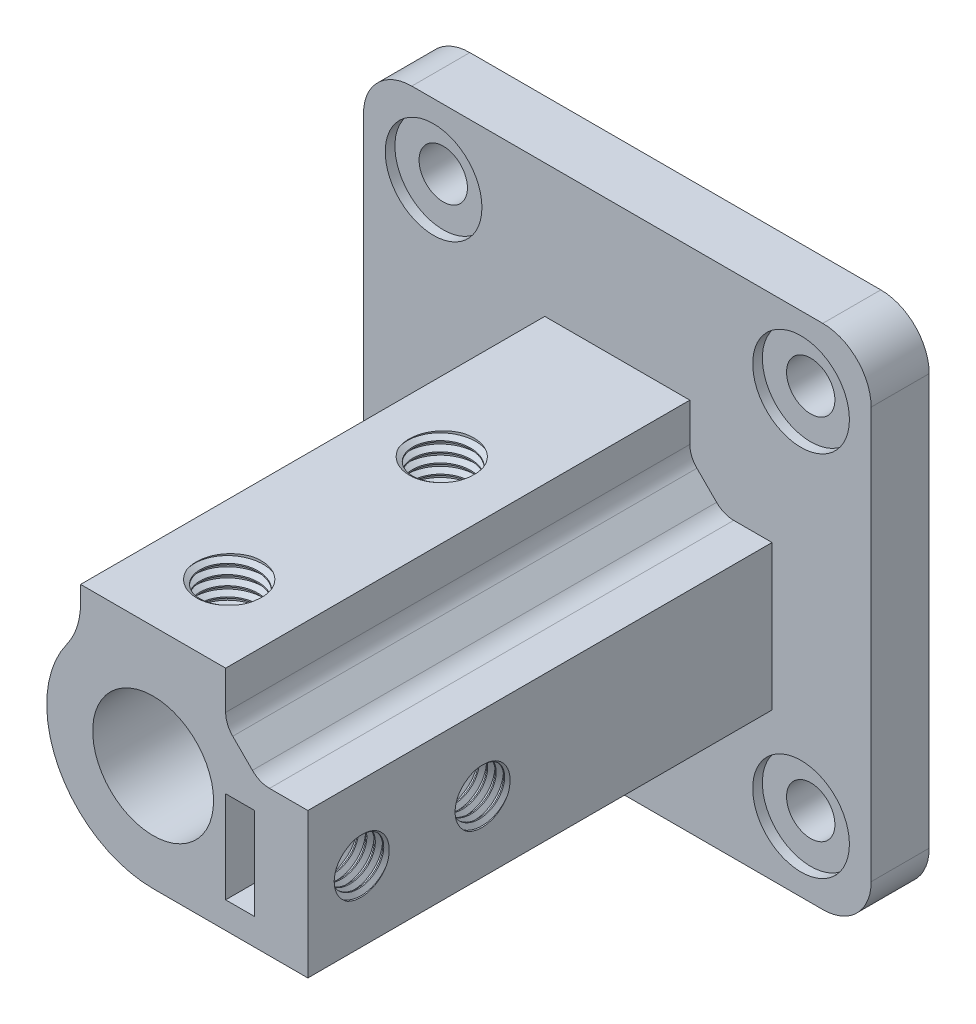
from build123d import *

# Parameters (mm, degrees)
BOSS_EXTRUDE1_DEPTH                     = 12
BOSS_EXTRUDE2_DEPTH                     = 108
CUT_EXTRUDE1_START                      = 108
SKETCH1_5_W                             = 6
SKETCH1_5_H                             = 19
CUT_EXTRUDE1_DEPTH                      = 48
F_25_0MM_DOWEL_HOLE1_D                  = 25
F_25_0MM_DOWEL_HOLE1_DEPTH              = 74.489242262
F_25_0MM_DOWEL_HOLE1_TIP                = 7.510757738
CBORE_FOR_M5_HEX_HEAD_BOLT1_D           = 10
CBORE_FOR_M5_HEX_HEAD_BOLT1_CBORE_D     = 20
CBORE_FOR_M5_HEX_HEAD_BOLT1_CBORE_DEPTH = 2
M12X1_75_TAPPED_HOLE1_D                 = 10.2
M12X1_75_TAPPED_HOLE1_DEPTH             = 11
M12X1_75_TAPPED_HOLE1_TIP               = 3.064389157
THREAD1_PITCH                           = 1.75
THREAD2_PITCH                           = 1.75
M14X2_0_TAPPED_HOLE1_REACH              = 133.25
M14X2_0_TAPPED_HOLE1_BORE_R             = 6
THREAD3_PITCH                           = 2
THREAD4_PITCH                           = 2


with BuildPart() as part:
    # Sketch1 → Boss-Extrude1 (new body)
    with BuildSketch(Plane.XY):
        with BuildLine():
            Line((-42.5, 52.5), (42.5, 52.5))
            ThreePointArc((42.5, 52.5), (49.571067812, 49.571067812), (52.5, 42.5))
            Line((52.5, 42.5), (52.5, -42.5))
            ThreePointArc((52.5, -42.5), (49.571067812, -49.571067812), (42.5, -52.5))
            Line((42.5, -52.5), (-42.5, -52.5))
            ThreePointArc((-42.5, -52.5), (-49.571067812, -49.571067812), (-52.5, -42.5))
            Line((-52.5, -42.5), (-52.5, 42.5))
            ThreePointArc((-52.5, 42.5), (-49.571067812, 49.571067812), (-42.5, 52.5))
        make_face()
    extrude(amount=BOSS_EXTRUDE1_DEPTH)

    # Sketch1<4> → Boss-Extrude2 (add)
    with BuildSketch(Plane.XY):
        with BuildLine():
            Line((-15, 25), (15, 25))
            Line((15, 25), (15, 17.071067812))
            ThreePointArc((15, 17.071067812), (15.380602337, 15.15765065), (16.464466094, 13.535533906))
            Line((16.464466094, 13.535533906), (20.535533906, 9.464466094))
            ThreePointArc((20.535533906, 9.464466094), (22.15765065, 8.380602337), (24.071067812, 8))
            Line((24.071067812, 8), (32, 8))
            Line((32, 8), (32, -22))
            Line((32, -22), (0, -22))
            ThreePointArc((0, -22), (-19.586847969, -10.017753573), (-17.837837838, 12.876783033))
            ThreePointArc((-17.837837838, 12.876783033), (-15.72708102, 17.042972688), (-15, 21.656407828))
            Line((-15, 21.656407828), (-15, 25))
        make_face()
    extrude(amount=BOSS_EXTRUDE2_DEPTH)

    # Sketch1<5> → Cut-Extrude1 (cut)
    with BuildSketch(Plane.XY.offset(CUT_EXTRUDE1_START)):
        with Locations((18, -7)):
            Rectangle(SKETCH1_5_W, SKETCH1_5_H)
    extrude(amount=-CUT_EXTRUDE1_DEPTH, mode=Mode.SUBTRACT)

    # Ø25.0mm Dowel Hole1
    with Locations(Plane.XY.offset(108)):
        with Locations((0, 0)):
            Hole(F_25_0MM_DOWEL_HOLE1_D / 2, depth=F_25_0MM_DOWEL_HOLE1_DEPTH)
            with Locations((0, 0, -(F_25_0MM_DOWEL_HOLE1_DEPTH + F_25_0MM_DOWEL_HOLE1_TIP / 2))):  # 118° drill point
                Cone(0, F_25_0MM_DOWEL_HOLE1_D / 2, F_25_0MM_DOWEL_HOLE1_TIP, mode=Mode.SUBTRACT)

    # CBORE for M5 Hex Head Bolt1 (through all)
    with Locations(Plane(origin=(37.999995657, 38.025691776, 12), x_dir=(1, 0, 0), z_dir=(0, 0, 1))):
        with Locations((0, 0), (-75.999995657, -0.025691776)):
            cbore_for_m5_hex_head_bolt1 = CounterBoreHole(CBORE_FOR_M5_HEX_HEAD_BOLT1_D / 2, CBORE_FOR_M5_HEX_HEAD_BOLT1_CBORE_D / 2, CBORE_FOR_M5_HEX_HEAD_BOLT1_CBORE_DEPTH)

    # Mirror1: CBORE for M5 Hex Head Bolt1 across plane
    add(cbore_for_m5_hex_head_bolt1.mirror(Plane.ZX), mode=Mode.SUBTRACT)

    # M12x1.75 Tapped Hole1
    with Locations(Plane(origin=(32, -7, 97), x_dir=(0, 0, 1), z_dir=(1, 0, 0))):
        with Locations((0, 0), (-25, 0)):
            Hole(M12X1_75_TAPPED_HOLE1_D / 2, depth=M12X1_75_TAPPED_HOLE1_DEPTH)
            with Locations((0, 0, -(M12X1_75_TAPPED_HOLE1_DEPTH + M12X1_75_TAPPED_HOLE1_TIP / 2))):  # 118° drill point
                Cone(0, M12X1_75_TAPPED_HOLE1_D / 2, M12X1_75_TAPPED_HOLE1_TIP, mode=Mode.SUBTRACT)

    # Thread1: the profile of Thread Profile1 profile screwed along a right-hand helix of 8.571429 turns, 10 arcs to a turn; built about Z, then put on its axis
    thread1_z = Axis((0, 0, 0), (0, 0, 1))
    thread1_corners = [(5.0997, 0, -0.000173205), (5.0997, 0, 1.5314232), (6.047215281, 0, 0.984374998), (6.047215281, 0, 0.546874998)]
    with BuildLine(mode=Mode.PRIVATE) as thread1_profile:
        Line(thread1_corners[0], thread1_corners[1])
        Line(thread1_corners[1], thread1_corners[2])
        Line(thread1_corners[2], thread1_corners[3])
        Line(thread1_corners[3], thread1_corners[0])
    thread1_cap = Face(thread1_profile.wire())
    thread1_turn_angles = [0, 18, 36, 54, 72, 90, 108, 126, 144, 162, 180, 198, 216, 234, 252, 270, 288, 306, 324, 342, 360]
    thread1_turn_weights = [1, 0.9510565162951535, 1, 0.9510565162951535, 1, 0.9510565162951535, 1, 0.9510565162951535, 1, 0.9510565162951535, 1, 0.9510565162951535, 1, 0.9510565162951535, 1, 0.9510565162951535, 1, 0.9510565162951535, 1, 0.9510565162951535, 1]
    thread1_turn_rails = [Edge.make_bspline([Vector(p[0], p[1], 0).rotate(thread1_z, thread1_turn_angles[k]) / thread1_turn_weights[k] + Vector(0, 0, p[2] + THREAD1_PITCH * thread1_turn_angles[k] / 360) for k in range(21)], [0, 0, 0, 1, 1, 2, 2, 3, 3, 4, 4, 5, 5, 6, 6, 7, 7, 8, 8, 9, 9, 10, 10, 10], 2, thread1_turn_weights) for p in thread1_corners]
    thread1_turn_sides = [Face.make_surface_from_curves(thread1_turn_rails[p[0]], thread1_turn_rails[p[1]]) for p in [(0, 1), (1, 2), (2, 3), (3, 0)]]
    thread1_last_angles = [2880, 2898, 2916, 2934, 2952, 2970, 2988, 3006, 3024, 3042, 3060, 3072.857142857, 3085.714285714]
    thread1_last_weights = [1, 0.9510565162951535, 1, 0.9510565162951535, 1, 0.9510565162951535, 1, 0.9510565162951535, 1, 0.9510565162951535, 1, 0.9749279121818235, 1]
    thread1_last_rails = [Edge.make_bspline([Vector(p[0], p[1], 0).rotate(thread1_z, thread1_last_angles[k]) / thread1_last_weights[k] + Vector(0, 0, p[2] + THREAD1_PITCH * thread1_last_angles[k] / 360) for k in range(13)], [0, 0, 0, 1, 1, 2, 2, 3, 3, 4, 4, 5, 5, 6, 6, 6], 2, thread1_last_weights) for p in thread1_corners]
    thread1_last_sides = [Face.make_surface_from_curves(thread1_last_rails[p[0]], thread1_last_rails[p[1]]) for p in [(0, 1), (1, 2), (2, 3), (3, 0)]]
    thread1 = Plane(origin=(34, -7, 72), x_dir=(0, 0, 1), z_dir=(-1, 0, 0)) * Solid(Shell([*[p.moved(Location((0, 0, THREAD1_PITCH * i))) for i in range(8) for p in thread1_turn_sides], *thread1_last_sides, thread1_cap, thread1_cap.rotate(thread1_z, 3085.714285714).moved(Location((0, 0, THREAD1_PITCH * 3085.714285714 / 360)))]))
    add(thread1, mode=Mode.SUBTRACT)

    # Thread2: the profile of Thread Profile2 profile screwed along a right-hand helix of 8.571429 turns, 10 arcs to a turn; built about Z, then put on its axis
    thread2_z = Axis((0, 0, 0), (0, 0, 1))
    thread2_corners = [(5.0997, 0, -0.000173205), (5.0997, 0, 1.5314232), (6.047215281, 0, 0.984374998), (6.047215281, 0, 0.546874998)]
    with BuildLine(mode=Mode.PRIVATE) as thread2_profile:
        Line(thread2_corners[0], thread2_corners[1])
        Line(thread2_corners[1], thread2_corners[2])
        Line(thread2_corners[2], thread2_corners[3])
        Line(thread2_corners[3], thread2_corners[0])
    thread2_cap = Face(thread2_profile.wire())
    thread2_turn_angles = [0, 18, 36, 54, 72, 90, 108, 126, 144, 162, 180, 198, 216, 234, 252, 270, 288, 306, 324, 342, 360]
    thread2_turn_weights = [1, 0.9510565162951535, 1, 0.9510565162951535, 1, 0.9510565162951535, 1, 0.9510565162951535, 1, 0.9510565162951535, 1, 0.9510565162951535, 1, 0.9510565162951535, 1, 0.9510565162951535, 1, 0.9510565162951535, 1, 0.9510565162951535, 1]
    thread2_turn_rails = [Edge.make_bspline([Vector(p[0], p[1], 0).rotate(thread2_z, thread2_turn_angles[k]) / thread2_turn_weights[k] + Vector(0, 0, p[2] + THREAD2_PITCH * thread2_turn_angles[k] / 360) for k in range(21)], [0, 0, 0, 1, 1, 2, 2, 3, 3, 4, 4, 5, 5, 6, 6, 7, 7, 8, 8, 9, 9, 10, 10, 10], 2, thread2_turn_weights) for p in thread2_corners]
    thread2_turn_sides = [Face.make_surface_from_curves(thread2_turn_rails[p[0]], thread2_turn_rails[p[1]]) for p in [(0, 1), (1, 2), (2, 3), (3, 0)]]
    thread2_last_angles = [2880, 2898, 2916, 2934, 2952, 2970, 2988, 3006, 3024, 3042, 3060, 3072.857142857, 3085.714285714]
    thread2_last_weights = [1, 0.9510565162951535, 1, 0.9510565162951535, 1, 0.9510565162951535, 1, 0.9510565162951535, 1, 0.9510565162951535, 1, 0.9749279121818235, 1]
    thread2_last_rails = [Edge.make_bspline([Vector(p[0], p[1], 0).rotate(thread2_z, thread2_last_angles[k]) / thread2_last_weights[k] + Vector(0, 0, p[2] + THREAD2_PITCH * thread2_last_angles[k] / 360) for k in range(13)], [0, 0, 0, 1, 1, 2, 2, 3, 3, 4, 4, 5, 5, 6, 6, 6], 2, thread2_last_weights) for p in thread2_corners]
    thread2_last_sides = [Face.make_surface_from_curves(thread2_last_rails[p[0]], thread2_last_rails[p[1]]) for p in [(0, 1), (1, 2), (2, 3), (3, 0)]]
    thread2 = Plane(origin=(34, -7, 97), x_dir=(0, 0, 1), z_dir=(-1, 0, 0)) * Solid(Shell([*[p.moved(Location((0, 0, THREAD2_PITCH * i))) for i in range(8) for p in thread2_turn_sides], *thread2_last_sides, thread2_cap, thread2_cap.rotate(thread2_z, 3085.714285714).moved(Location((0, 0, THREAD2_PITCH * 3085.714285714 / 360)))]))
    add(thread2, mode=Mode.SUBTRACT)

    # M14x2.0 Tapped Hole1 bore (on position points) → M14x2.0 Tapped Hole1 (cut, up to next)
    with BuildSketch(Plane(origin=(0, 25, 92), x_dir=(1, 0, 0), z_dir=(0, 1, 0)), mode=Mode.PRIVATE) as m14x2_0_tapped_hole1_sk1:
        Circle(M14X2_0_TAPPED_HOLE1_BORE_R)
    m14x2_0_tapped_hole1_tool1 = extrude(m14x2_0_tapped_hole1_sk1.sketch, amount=-M14X2_0_TAPPED_HOLE1_REACH, mode=Mode.PRIVATE) & part.part
    # M14x2.0 Tapped Hole1 bore (on position points) → M14x2.0 Tapped Hole1 (cut, up to next)
    with BuildSketch(Plane(origin=(0, 25, 92), x_dir=(1, 0, 0), z_dir=(0, 1, 0)), mode=Mode.PRIVATE) as m14x2_0_tapped_hole1_sk2:
        with Locations((0, 44)):
            Circle(M14X2_0_TAPPED_HOLE1_BORE_R)
    m14x2_0_tapped_hole1_tool2 = extrude(m14x2_0_tapped_hole1_sk2.sketch, amount=-M14X2_0_TAPPED_HOLE1_REACH, mode=Mode.PRIVATE) & part.part
    add(m14x2_0_tapped_hole1_tool1.solids().sort_by_distance((0, 25, 92))[0], mode=Mode.SUBTRACT)
    add(m14x2_0_tapped_hole1_tool2.solids().sort_by_distance((0, 25, 48))[0], mode=Mode.SUBTRACT)

    # Thread3: the profile of Thread Profile3 profile screwed along a right-hand helix of 10 turns, 10 arcs to a turn; built about Z, then put on its axis
    thread3_z = Axis((0, 0, 0), (0, 0, 1))
    thread3_corners = [(5.9997, 0, -0.000173205), (5.9997, 0, 1.7501732), (7.08253175, 0, 1.124999997), (7.08253175, 0, 0.624999997)]
    with BuildLine(mode=Mode.PRIVATE) as thread3_profile:
        Line(thread3_corners[0], thread3_corners[1])
        Line(thread3_corners[1], thread3_corners[2])
        Line(thread3_corners[2], thread3_corners[3])
        Line(thread3_corners[3], thread3_corners[0])
    thread3_cap = Face(thread3_profile.wire())
    thread3_turn_angles = [0, 18, 36, 54, 72, 90, 108, 126, 144, 162, 180, 198, 216, 234, 252, 270, 288, 306, 324, 342, 360]
    thread3_turn_weights = [1, 0.9510565162951535, 1, 0.9510565162951535, 1, 0.9510565162951535, 1, 0.9510565162951535, 1, 0.9510565162951535, 1, 0.9510565162951535, 1, 0.9510565162951535, 1, 0.9510565162951535, 1, 0.9510565162951535, 1, 0.9510565162951535, 1]
    thread3_turn_rails = [Edge.make_bspline([Vector(p[0], p[1], 0).rotate(thread3_z, thread3_turn_angles[k]) / thread3_turn_weights[k] + Vector(0, 0, p[2] + THREAD3_PITCH * thread3_turn_angles[k] / 360) for k in range(21)], [0, 0, 0, 1, 1, 2, 2, 3, 3, 4, 4, 5, 5, 6, 6, 7, 7, 8, 8, 9, 9, 10, 10, 10], 2, thread3_turn_weights) for p in thread3_corners]
    thread3_turn_sides = [Face.make_surface_from_curves(thread3_turn_rails[p[0]], thread3_turn_rails[p[1]]) for p in [(0, 1), (1, 2), (2, 3), (3, 0)]]
    thread3 = Plane(origin=(0, 28, 48), x_dir=(-1, 0, 0), z_dir=(0, -1, 0)) * Solid(Shell([*[p.moved(Location((0, 0, THREAD3_PITCH * i))) for i in range(10) for p in thread3_turn_sides], thread3_cap, thread3_cap.rotate(thread3_z, 3600).moved(Location((0, 0, THREAD3_PITCH * 3600 / 360)))]))
    add(thread3, mode=Mode.SUBTRACT)

    # Thread4: the profile of Thread Profile4 profile screwed along a right-hand helix of 10 turns, 10 arcs to a turn; built about Z, then put on its axis
    thread4_z = Axis((0, 0, 0), (0, 0, 1))
    thread4_corners = [(5.9997, 2e-09, -0.000173205), (5.9997, 2e-09, 1.7501732), (7.08253175, 2e-09, 1.124999997), (7.08253175, 2e-09, 0.624999997)]
    with BuildLine(mode=Mode.PRIVATE) as thread4_profile:
        Line(thread4_corners[0], thread4_corners[1])
        Line(thread4_corners[1], thread4_corners[2])
        Line(thread4_corners[2], thread4_corners[3])
        Line(thread4_corners[3], thread4_corners[0])
    thread4_cap = Face(thread4_profile.wire())
    thread4_turn_angles = [0, 18, 36, 54, 72, 90, 108, 126, 144, 162, 180, 198, 216, 234, 252, 270, 288, 306, 324, 342, 360]
    thread4_turn_weights = [1, 0.9510565162951535, 1, 0.9510565162951535, 1, 0.9510565162951535, 1, 0.9510565162951535, 1, 0.9510565162951535, 1, 0.9510565162951535, 1, 0.9510565162951535, 1, 0.9510565162951535, 1, 0.9510565162951535, 1, 0.9510565162951535, 1]
    thread4_turn_rails = [Edge.make_bspline([Vector(p[0], p[1], 0).rotate(thread4_z, thread4_turn_angles[k]) / thread4_turn_weights[k] + Vector(0, 0, p[2] + THREAD4_PITCH * thread4_turn_angles[k] / 360) for k in range(21)], [0, 0, 0, 1, 1, 2, 2, 3, 3, 4, 4, 5, 5, 6, 6, 7, 7, 8, 8, 9, 9, 10, 10, 10], 2, thread4_turn_weights) for p in thread4_corners]
    thread4_turn_sides = [Face.make_surface_from_curves(thread4_turn_rails[p[0]], thread4_turn_rails[p[1]]) for p in [(0, 1), (1, 2), (2, 3), (3, 0)]]
    thread4 = Plane(origin=(0, 28, 92), x_dir=(-0.998629535, 0, -0.052335956), z_dir=(0, -1, 0)) * Solid(Shell([*[p.moved(Location((0, 0, THREAD4_PITCH * i))) for i in range(10) for p in thread4_turn_sides], thread4_cap, thread4_cap.rotate(thread4_z, 3600).moved(Location((0, 0, THREAD4_PITCH * 3600 / 360)))]))
    add(thread4, mode=Mode.SUBTRACT)


solid = part.part
